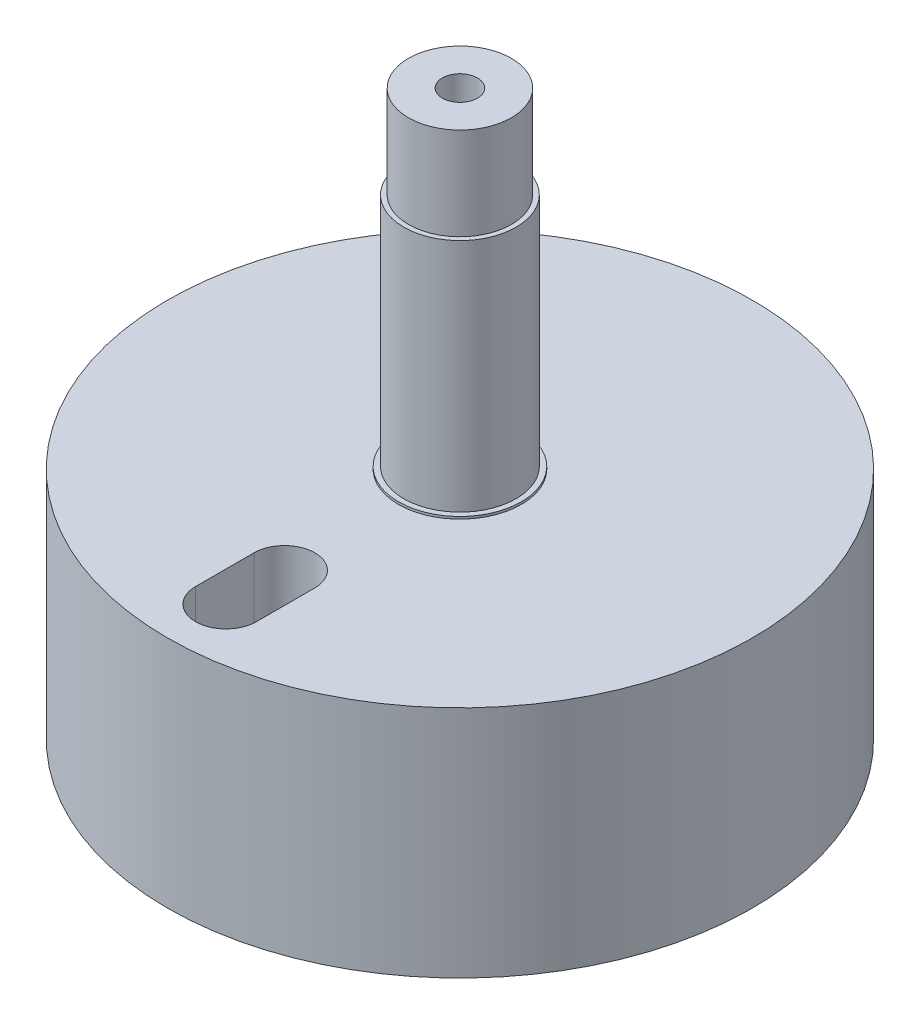
from build123d import *

# Parameters (mm, degrees)
SKETCH1_R           = 25
BOSS_EXTRUDE1_DEPTH = 20
CUT_EXTRUDE2_DEPTH  = 10
SKETCH5_R           = 1.5
CUT_EXTRUDE3_DEPTH  = 37.742346142
SKETCH2_R           = 5.25
BOSS_EXTRUDE2_DEPTH = 0.2
SKETCH7_R           = 4.8
BOSS_EXTRUDE3_DEPTH = 20.1
SKETCH8_R           = 4.4
BOSS_EXTRUDE4_DEPTH = 7.9
SKETCH6_R           = 1.5
CUT_EXTRUDE4_DEPTH  = 60.776584044


with BuildPart() as part:
    # Sketch1 → Boss-Extrude1 (new body)
    with BuildSketch(Plane(origin=(0, 0, 0), x_dir=(1, 0, 0), z_dir=(0, 1, 0))):
        Circle(SKETCH1_R)
    extrude(amount=BOSS_EXTRUDE1_DEPTH)

    # Sketch3 → Cut-Extrude2 (cut)
    with BuildSketch(Plane(origin=(0, 20, 0), x_dir=(1, 0, 0), z_dir=(0, 1, 0))):
        with BuildLine():
            Line((-2.6, -15), (-2.6, -20))
            ThreePointArc((-2.6, -20), (0, -22.6), (2.6, -20))
            Line((2.6, -20), (2.6, -15))
            ThreePointArc((2.6, -15), (0, -12.4), (-2.6, -15))
        make_face()
    extrude(amount=-CUT_EXTRUDE2_DEPTH, mode=Mode.SUBTRACT)

    # Sketch5 → Cut-Extrude3 (cut, through all)
    with BuildSketch(Plane(origin=(0, 10, 0), x_dir=(1, 0, 0), z_dir=(0, 1, 0))):
        with Locations((0, -17.5)):
            Circle(SKETCH5_R)
    extrude(amount=-CUT_EXTRUDE3_DEPTH, mode=Mode.SUBTRACT)

    # Sketch2 → Boss-Extrude2 (add)
    with BuildSketch(Plane(origin=(0, 20, 0), x_dir=(1, 0, 0), z_dir=(0, 1, 0))):
        Circle(SKETCH2_R)
    extrude(amount=BOSS_EXTRUDE2_DEPTH)

    # Sketch7 → Boss-Extrude3 (add)
    with BuildSketch(Plane(origin=(0, 20.2, 0), x_dir=(1, 0, 0), z_dir=(0, 1, 0))):
        Circle(SKETCH7_R)
    extrude(amount=BOSS_EXTRUDE3_DEPTH)

    # Sketch8 → Boss-Extrude4 (add)
    with BuildSketch(Plane(origin=(0, 40.3, 0), x_dir=(1, 0, 0), z_dir=(0, 1, 0))):
        Circle(SKETCH8_R)
    extrude(amount=BOSS_EXTRUDE4_DEPTH)

    # Sketch6 → Cut-Extrude4 (cut, through all)
    with BuildSketch(Plane.XZ):
        Circle(SKETCH6_R)
    extrude(amount=-CUT_EXTRUDE4_DEPTH, mode=Mode.SUBTRACT)


solid = part.part
